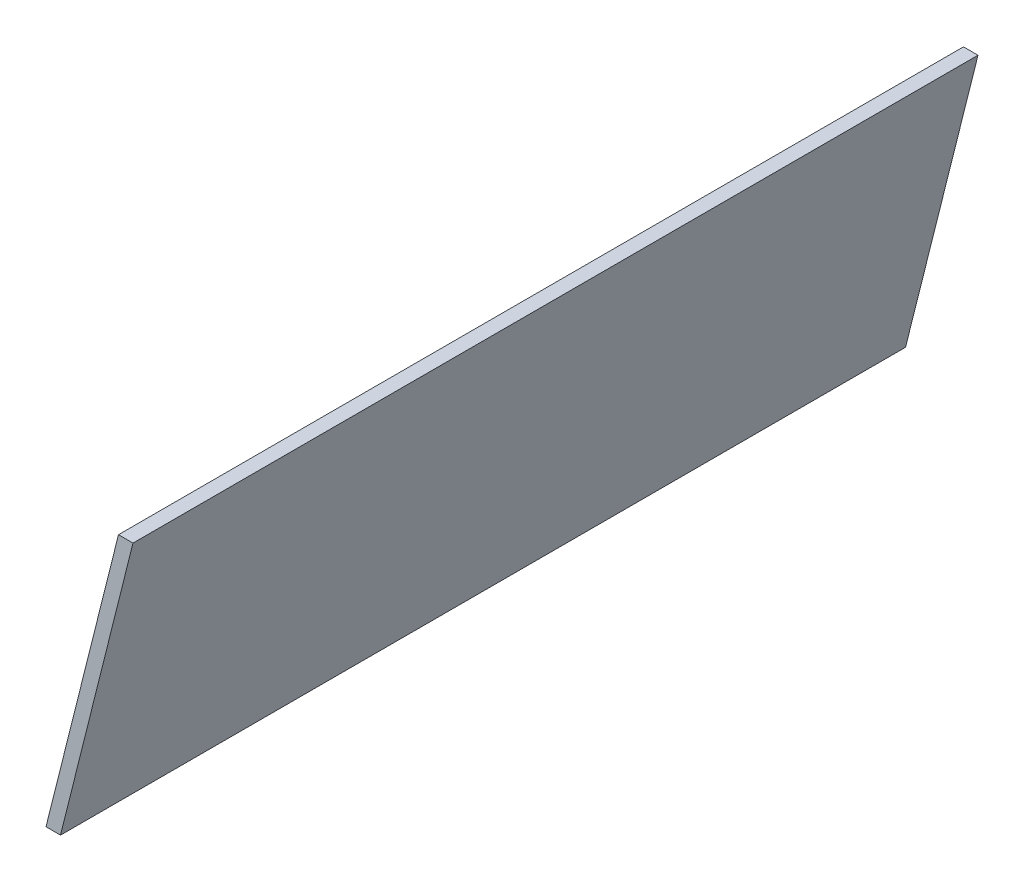
from build123d import *

# Parameters (mm, degrees)
BOSS_EXTRUDE1_DEPTH = 277.475


with BuildPart() as part:
    # Sketch1 → Boss-Extrude1 (new body)
    with BuildSketch(Plane.XY):
        Polygon((-40.901707192, -38.824877845), (-36.139207192, -38.824877845), (-12.339016756, 56.138067219), (-17.101516756, 56.138067219), align=None)
    extrude(amount=BOSS_EXTRUDE1_DEPTH)


solid = part.part
